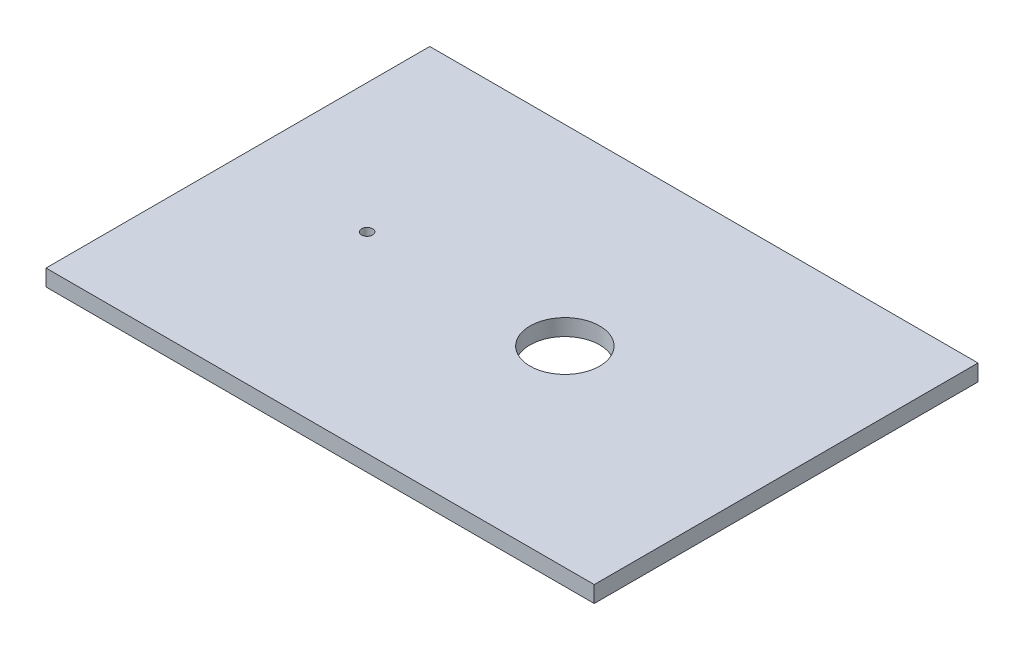
from build123d import *

# Parameters (mm, degrees)
SKETCH2_W          = 100
SKETCH2_H          = 70
BASE_FLANGE1_DEPTH = 3
SKETCH7_R          = 1
SKETCH7_R_2        = 6.35
CUT_EXTRUDE1_DEPTH = 10


# Sheet-metal steps are written as plain solids
with BuildPart() as part:
    # Sketch2 → Base-Flange1 (new body)
    with BuildSketch(Plane(origin=(0, 0, 0), x_dir=(1, 0, 0), z_dir=(0, 1, 0))):
        Rectangle(SKETCH2_W, SKETCH2_H)
    extrude(amount=-BASE_FLANGE1_DEPTH)

    # Sketch7 → Cut-Extrude1 (cut)
    with BuildSketch(Plane(origin=(0, 0, 0), x_dir=(1, 0, 0), z_dir=(0, 1, 0))):
        with Locations(Location((-26.43, 0, 0), (0, 0, 270))):
            Circle(SKETCH7_R)
        with Locations(Location((9.64, 0, 0), (0, 0, 270))):
            Circle(SKETCH7_R_2)
    extrude(amount=-CUT_EXTRUDE1_DEPTH, mode=Mode.SUBTRACT)


solid = part.part
